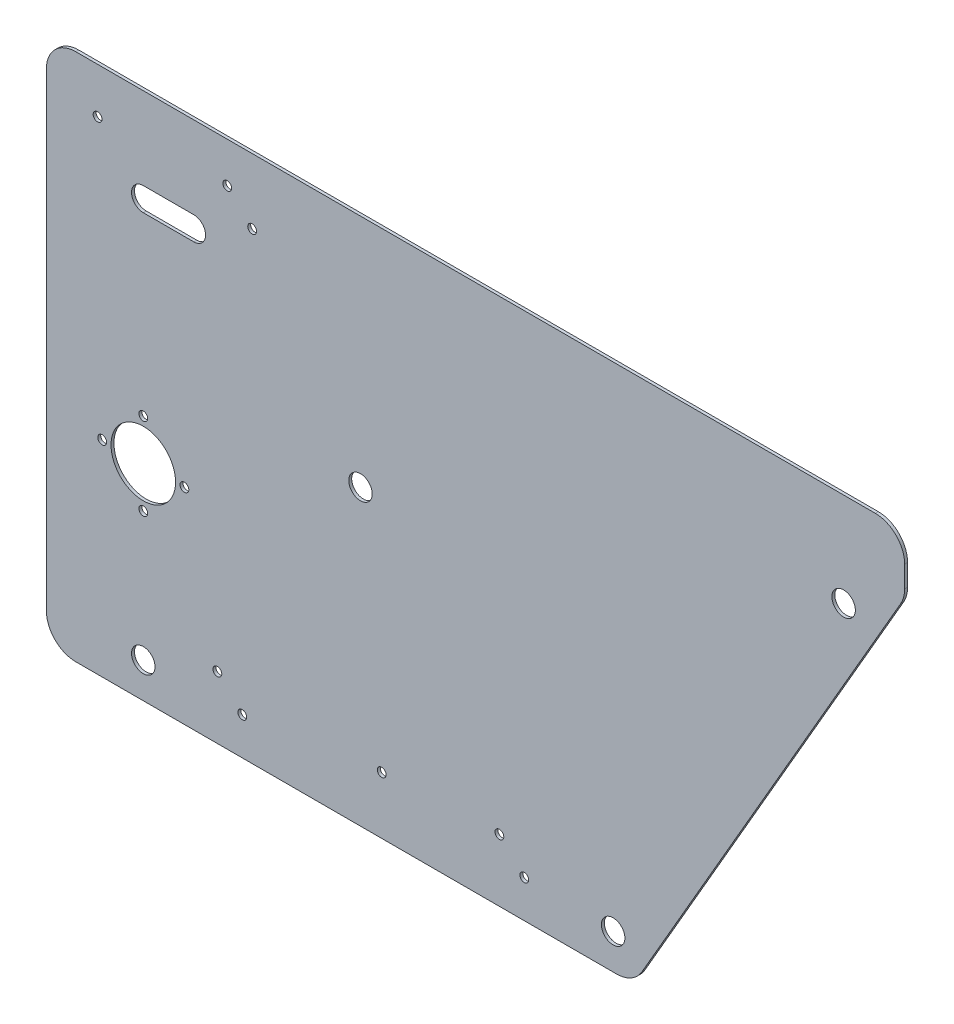
from build123d import *

# Parameters (mm, degrees)
BOSS_EXTRUDE1_DEPTH = 1
FILLET1_R           = 10
SKETCH2_R           = 4
SKETCH2_R_2         = 11
SKETCH2_R_3         = 1.5
CUT_EXTRUDE1_DEPTH  = 3


with BuildPart() as part:
    # Sketch1 → Boss-Extrude1 (new body)
    with BuildSketch(Plane.XY):
        Polygon((-100, 100), (-100, -80), (100, -80), (192.37604307, 80), (192.37604307, 100), align=None)
    extrude(amount=BOSS_EXTRUDE1_DEPTH)

    # Fillet1
    fillet1_edges = [part.edges().sort_by_distance(p)[0] for p in [
        (100, -80, 0.5),
        (-100, -80, 0.5),
        (192.37604307, 100, 0.5),
        (-100, 100, 0.5),
        (192.37604307, 80, 0.5),
    ]]
    fillet(fillet1_edges, radius=FILLET1_R)

    # Sketch2 → Cut-Extrude1 (cut)
    with BuildSketch(Plane.XY.offset(1)):
        with Locations((93.07179677, -68)):
            Circle(SKETCH2_R)
        with Locations((171.59143338, 68)):
            Circle(SKETCH2_R)
        with Locations((-67, -10)):
            Circle(SKETCH2_R_2)
        with Locations((-67, -68)):
            Circle(SKETCH2_R)
        with Locations((-53, -10)):
            Circle(SKETCH2_R_3)
        with Locations((-67, 4)):
            Circle(SKETCH2_R_3)
        with Locations((-81, -10)):
            Circle(SKETCH2_R_3)
        with Locations((-67, -24)):
            Circle(SKETCH2_R_3)
        with Locations((6.998807119, 20)):
            Circle(SKETCH2_R)
        with Locations((62.79605759, -67.242640687)):
            Circle(SKETCH2_R_3)
        with Locations((54.310776216, -58.757359313)):
            Circle(SKETCH2_R_3)
        with Locations((-33.274226936, -67.242640687)):
            Circle(SKETCH2_R_3)
        with Locations((-41.75950831, -58.757359313)):
            Circle(SKETCH2_R_3)
        with Locations((14.225855729, -60.5)):
            Circle(SKETCH2_R_3)
        with Locations((-29.915208807, 77.757359313)):
            Circle(SKETCH2_R_3)
        with Locations((-38.400490181, 86.242640687)):
            Circle(SKETCH2_R_3)
        with Locations((-82.576317869, 84.5)):
            Circle(SKETCH2_R_3)
        with BuildLine():
            Line((-67, 72), (-49.783746602, 72))
            ThreePointArc((-49.783746602, 72), (-45.783746602, 68), (-49.783746602, 64))
            Line((-49.783746602, 64), (-67, 64))
            ThreePointArc((-67, 64), (-71, 68), (-67, 72))
        make_face()
    extrude(amount=-CUT_EXTRUDE1_DEPTH, mode=Mode.SUBTRACT)


solid = part.part
